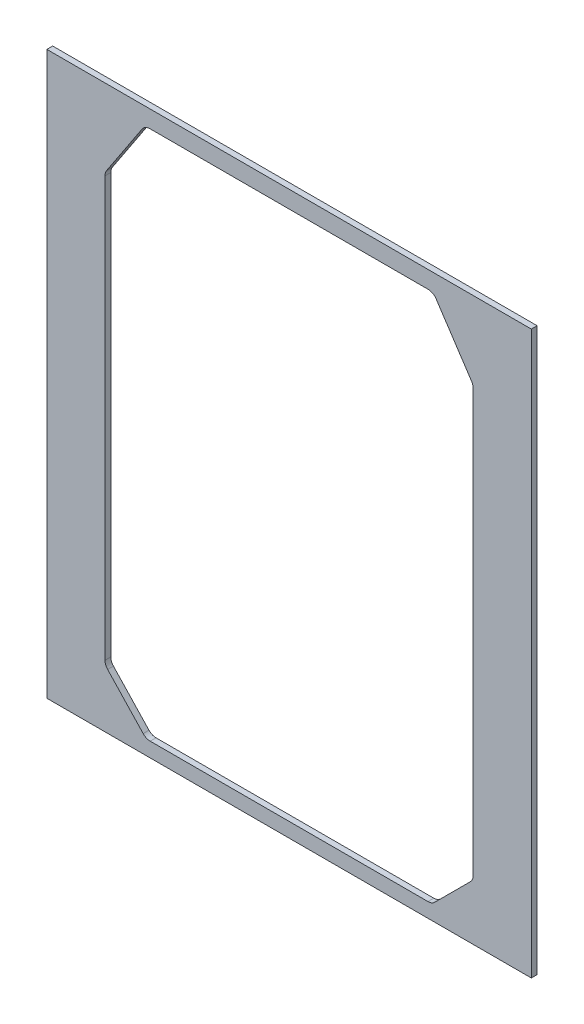
from build123d import *

# Parameters (mm, degrees)
SKETCH_1_W      = 500
SKETCH_1_H      = 580
EXTRUDE_1_DEPTH = 6


with BuildPart() as part:
    # Эскиз1 → Бобышка-Вытянуть1 (new body)
    with BuildSketch(Plane.XY):
        with Locations((192.327917168, 270.464227839)):
            Rectangle(SKETCH_1_W, SKETCH_1_H)
        with BuildLine():
            Line((2.327917168, 477.456530462), (2.327917168, 44.431098194))
            ThreePointArc((2.327917168, 44.431098194), (3.032569192, 40.743754162), (5.04721837, 37.576069017))
            Line((5.04721837, 37.576069017), (41.735871559, -1.390801337))
            ThreePointArc((41.735871559, -1.390801337), (45.05111274, -3.715921717), (49.016570358, -4.535772161))
            Line((49.016570358, -4.535772161), (192.327917168, -4.535772161))
            Line((192.327917168, -4.535772161), (335.639263979, -4.535772161))
            ThreePointArc((335.639263979, -4.535772161), (339.466098302, -3.774567486), (342.710331791, -1.606839972))
            Line((342.710331791, -1.606839972), (379.39898498, 35.081813217))
            ThreePointArc((379.39898498, 35.081813217), (381.566712493, 38.326046705), (382.327917168, 42.152881029))
            Line((382.327917168, 42.152881029), (382.327917168, 477.456530462))
            ThreePointArc((382.327917168, 477.456530462), (381.904148866, 480.336771158), (380.668759875, 482.972900913))
            Line((380.668759875, 482.972900913), (344.110547273, 538.249518693))
            ThreePointArc((344.110547273, 538.249518693), (340.504485211, 541.541204342), (335.769704567, 542.733148243))
            Line((335.769704567, 542.733148243), (48.88612977, 542.733148243))
            ThreePointArc((48.88612977, 542.733148243), (44.151349126, 541.541204342), (40.545287063, 538.249518693))
            Line((40.545287063, 538.249518693), (3.987074462, 482.972900913))
            ThreePointArc((3.987074462, 482.972900913), (2.75168547, 480.336771158), (2.327917168, 477.456530462))
        make_face(mode=Mode.SUBTRACT)
    extrude(amount=EXTRUDE_1_DEPTH)


solid = part.part
